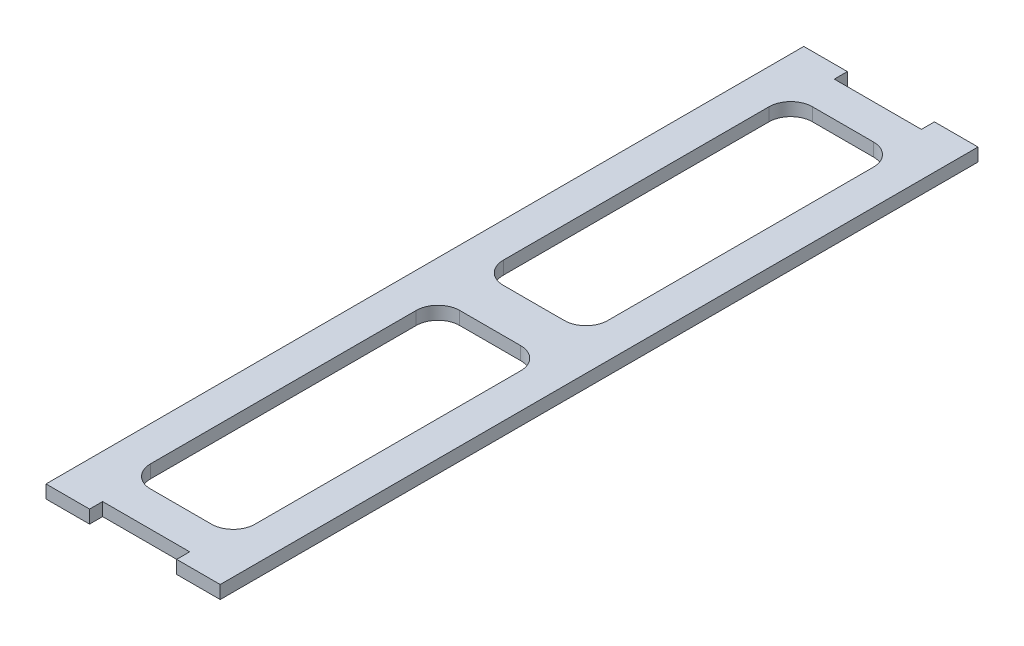
from build123d import *

# Parameters (mm, degrees)
DODANIE_WYCI_GNI_CIE1_DEPTH = 3


with BuildPart() as part:
    # Szkic1 → Dodanie-wyciągnięcie1 (new body)
    with BuildSketch(Plane(origin=(0, 0, 0), x_dir=(1, 0, 0), z_dir=(0, 1, 0))):
        Polygon((491.53629145, 27.137860171), (491.53629145, -59.862139829), (501.53629145, -59.862139829), (501.53629145, -56.862139829), (521.53629145, -56.862139829), (521.53629145, -59.862139829), (531.53629145, -59.862139829), (531.53629145, 27.137860171), (531.53629145, 114.137860171), (521.53629145, 114.137860171), (521.53629145, 111.137860171), (501.53629145, 111.137860171), (501.53629145, 114.137860171), (491.53629145, 114.137860171), align=None)
        with BuildLine():
            Line((499.53629145, 17.137860171), (499.53629145, -43.862139829))
            ThreePointArc((499.53629145, -43.862139829), (501.000757544, -47.397673735), (504.53629145, -48.862139829))
            Line((504.53629145, -48.862139829), (518.53629145, -48.862139829))
            ThreePointArc((518.53629145, -48.862139829), (522.071825356, -47.397673735), (523.53629145, -43.862139829))
            Line((523.53629145, -43.862139829), (523.53629145, 17.137860171))
            ThreePointArc((523.53629145, 17.137860171), (522.071825356, 20.673394077), (518.53629145, 22.137860171))
            Line((518.53629145, 22.137860171), (504.53629145, 22.137860171))
            ThreePointArc((504.53629145, 22.137860171), (501.000757544, 20.673394077), (499.53629145, 17.137860171))
        make_face(mode=Mode.SUBTRACT)
        with BuildLine():
            Line((499.53629145, 37.137860171), (499.53629145, 98.137860171))
            ThreePointArc((499.53629145, 98.137860171), (501.000757544, 101.673394077), (504.53629145, 103.137860171))
            Line((504.53629145, 103.137860171), (518.53629145, 103.137860171))
            ThreePointArc((518.53629145, 103.137860171), (522.071825356, 101.673394077), (523.53629145, 98.137860171))
            Line((523.53629145, 98.137860171), (523.53629145, 37.137860171))
            ThreePointArc((523.53629145, 37.137860171), (522.071825356, 33.602326265), (518.53629145, 32.137860171))
            Line((518.53629145, 32.137860171), (504.53629145, 32.137860171))
            ThreePointArc((504.53629145, 32.137860171), (501.000757544, 33.602326265), (499.53629145, 37.137860171))
        make_face(mode=Mode.SUBTRACT)
    extrude(amount=DODANIE_WYCI_GNI_CIE1_DEPTH)


solid = part.part
